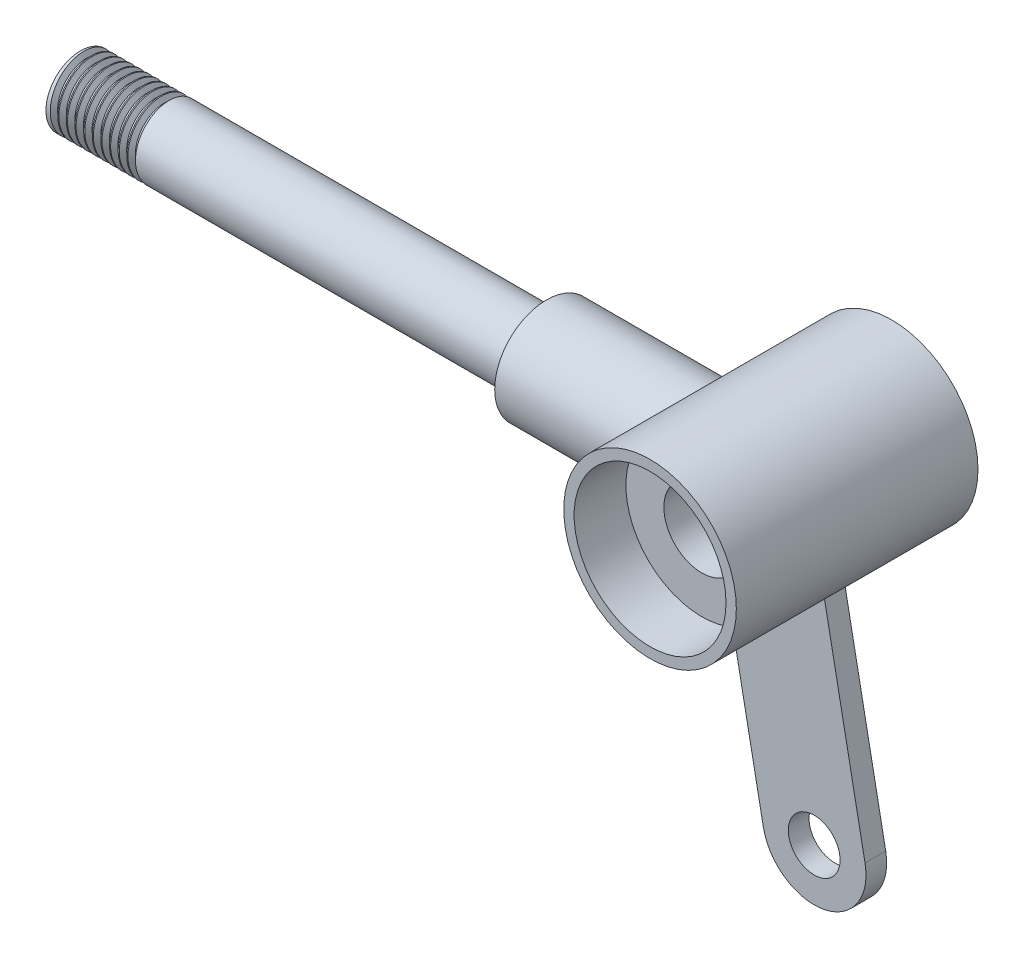
from build123d import *

# Parameters (mm, degrees)
SZKIC2_R                                     = 15
DODANIE_WYCI_GNI_CIE1_DEPTH                  = 40
DODANIE_WYCI_GNI_CIE1_DIRECTION_2_REACH      = 91.582
DODANIE_WYCI_GNI_CIE1_DIRECTION_2_END_RADIUS = 25
DODANIE_WYCI_GNI_CIE2_DEPTH                  = 3
DODANIE_WYCI_GNI_CIE2_DEPTH_BACK             = 3
WYTNIJ_WYCI_GNI_CIE1_REACH                   = 123.219
SZKIC4_R                                     = 7.5
SZKIC6_R                                     = 10
DODANIE_WYCI_GNI_CIE3_DEPTH                  = 135
GWINT1_PITCH                                 = 2.5


with BuildPart() as part:
    # Szkic1 → Obrót1 (revolve)
    with BuildSketch(Plane(origin=(0, 0, 0), x_dir=(1, 0, 0), z_dir=(0, 1, 0)), mode=Mode.PRIVATE) as obr_t1_sk:
        Polygon((-22, 55), (-22, 70), (-25, 70), (-25, 0), (-22, 0), (-22, 15), (-11, 15), (-11, 55), align=None)
    revolve(obr_t1_sk.sketch.rotate(Axis((0, 0, 0), (0, 0, -1)), 180), axis=Axis((0, 0, 0), (0, 0, -1)))

    # Szkic2 → Dodanie-wyciągnięcie1 (add)
    with BuildSketch(Plane.ZY.offset(25)):
        with Locations(Location((-35, 0, 0), (0, 0, 180))):
            Circle(SZKIC2_R)
    extrude(amount=DODANIE_WYCI_GNI_CIE1_DEPTH)

    # Dodanie-wyciągnięcie1 direction 2: up to this cylinder (the profile starts outside it)
    dodanie_wyci_gni_cie1_direction_2_end = Plane(origin=(0, 0, -35), z_dir=(0, 0, 1)) * Cylinder(DODANIE_WYCI_GNI_CIE1_DIRECTION_2_END_RADIUS, 234.164, mode=Mode.PRIVATE)
    # Szkic2 → Dodanie-wyciągnięcie1 direction 2 (add, up to the surface)
    with BuildSketch(Plane.ZY.offset(25), mode=Mode.PRIVATE) as dodanie_wyci_gni_cie1_direction_2_sk1:
        with Locations(Location((-35, 0, 0), (0, 0, 180))):
            Circle(SZKIC2_R)
    dodanie_wyci_gni_cie1_direction_2_tool1 = extrude(dodanie_wyci_gni_cie1_direction_2_sk1.sketch, amount=-DODANIE_WYCI_GNI_CIE1_DIRECTION_2_REACH, mode=Mode.PRIVATE) - dodanie_wyci_gni_cie1_direction_2_end
    add(dodanie_wyci_gni_cie1_direction_2_tool1.solids().sort_by_distance((-25, 0, -35))[0])
    add(dodanie_wyci_gni_cie1_direction_2_tool1.solids().sort_by_distance((-25, 0, -35))[1])

    # Szkic3 → Dodanie-wyciągnięcie2 (add, two sides: drawn at the far end of the back side and taken through both)
    with BuildSketch(Plane.XY.offset(-35).offset(-DODANIE_WYCI_GNI_CIE2_DEPTH_BACK)):
        with BuildLine():
            Line((30.274832483, -77.137865069), (17.2485735, -10.123572107))
            ThreePointArc((17.2485735, -10.123572107), (3.816179908, -19.632543669), (-12.200242003, -15.847841969))
            Line((-12.200242003, -15.847841969), (0.826016979, -82.862134931))
            ThreePointArc((0.826016979, -82.862134931), (18.412559662, -94.724407752), (30.274832483, -77.137865069))
        make_face()
    extrude(amount=DODANIE_WYCI_GNI_CIE2_DEPTH + DODANIE_WYCI_GNI_CIE2_DEPTH_BACK)

    # Szkic4 → Wytnij-wyciągnięcie1 (cut, up to next)
    with BuildSketch(Plane.XY.offset(-32), mode=Mode.PRIVATE) as wytnij_wyci_gni_cie1_sk1:
        with Locations((15.550424731, -80)):
            Circle(SZKIC4_R)
    wytnij_wyci_gni_cie1_tool1 = extrude(wytnij_wyci_gni_cie1_sk1.sketch, amount=-WYTNIJ_WYCI_GNI_CIE1_REACH, mode=Mode.PRIVATE) & part.part
    add(wytnij_wyci_gni_cie1_tool1.solids().sort_by_distance((15.550425, -80, -32))[0], mode=Mode.SUBTRACT)

    # Szkic6 → Dodanie-wyciągnięcie3 (add)
    with BuildSketch(Plane.ZY.offset(65)):
        with Locations((-35, 0)):
            Circle(SZKIC6_R)
    extrude(amount=DODANIE_WYCI_GNI_CIE3_DEPTH)

    # Gwint1: the profile of Profil gwintu1 profile screwed along a right-hand helix of 10 turns, 10 arcs to a turn; built about Z, then put on its axis
    gwint1_z = Axis((0, 0, 0), (0, 0, 1))
    gwint1_corners = [(10.0003, 0, -0.000173205), (10.0003, 0, 2.187673198), (8.646835313, 0, 1.406249997), (8.646835313, 0, 0.781249997)]
    with BuildLine(mode=Mode.PRIVATE) as gwint1_profile:
        Line(gwint1_corners[0], gwint1_corners[1])
        Line(gwint1_corners[1], gwint1_corners[2])
        Line(gwint1_corners[2], gwint1_corners[3])
        Line(gwint1_corners[3], gwint1_corners[0])
    gwint1_cap = Face(gwint1_profile.wire())
    gwint1_turn_angles = [0, 18, 36, 54, 72, 90, 108, 126, 144, 162, 180, 198, 216, 234, 252, 270, 288, 306, 324, 342, 360]
    gwint1_turn_weights = [1, 0.9510565162951535, 1, 0.9510565162951535, 1, 0.9510565162951535, 1, 0.9510565162951535, 1, 0.9510565162951535, 1, 0.9510565162951535, 1, 0.9510565162951535, 1, 0.9510565162951535, 1, 0.9510565162951535, 1, 0.9510565162951535, 1]
    gwint1_turn_rails = [Edge.make_bspline([Vector(p[0], p[1], 0).rotate(gwint1_z, gwint1_turn_angles[k]) / gwint1_turn_weights[k] + Vector(0, 0, p[2] + GWINT1_PITCH * gwint1_turn_angles[k] / 360) for k in range(21)], [0, 0, 0, 1, 1, 2, 2, 3, 3, 4, 4, 5, 5, 6, 6, 7, 7, 8, 8, 9, 9, 10, 10, 10], 2, gwint1_turn_weights) for p in gwint1_corners]
    gwint1_turn_sides = [Face.make_surface_from_curves(gwint1_turn_rails[p[0]], gwint1_turn_rails[p[1]]) for p in [(0, 1), (1, 2), (2, 3), (3, 0)]]
    gwint1 = Plane(origin=(-200, 0, -35), x_dir=(0, 0, -1), z_dir=(1, 0, 0)) * Solid(Shell([*[p.moved(Location((0, 0, GWINT1_PITCH * i))) for i in range(10) for p in gwint1_turn_sides], gwint1_cap, gwint1_cap.rotate(gwint1_z, 3600).moved(Location((0, 0, GWINT1_PITCH * 3600 / 360)))]))
    add(gwint1, mode=Mode.SUBTRACT)


solid = part.part
